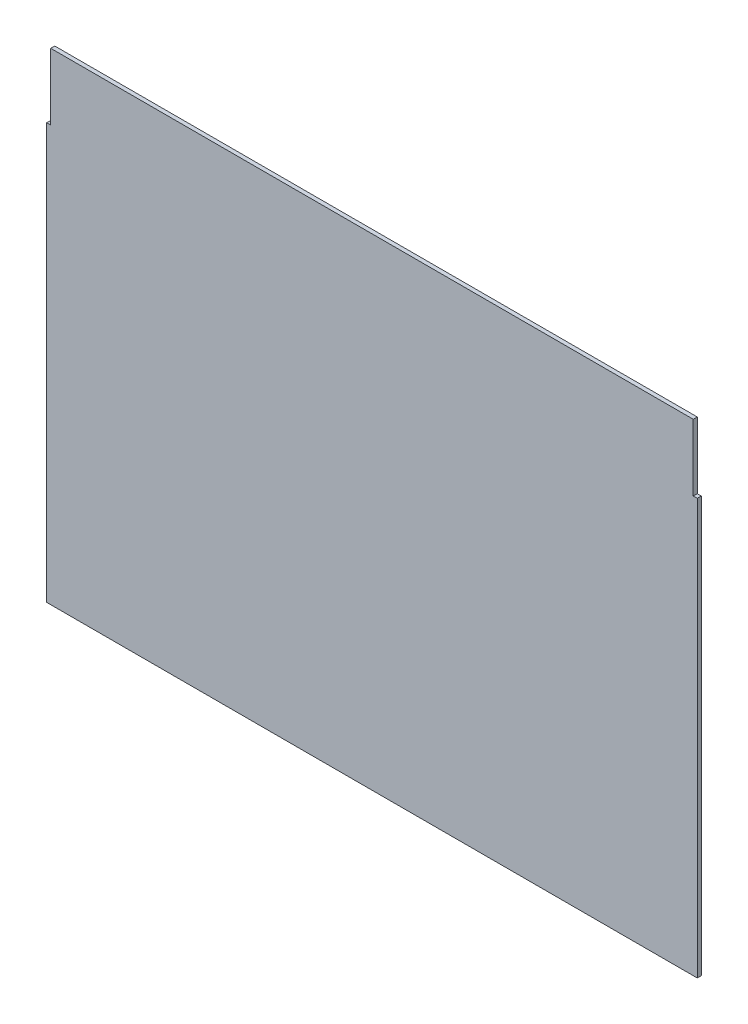
from build123d import *

# Parameters (mm, degrees)
SKETCH1_W           = 508
SKETCH1_H           = 381
BOSS_EXTRUDE1_DEPTH = 3.175
SKETCH4_W           = 3.175
SKETCH4_H           = 328.45375
BOSS_EXTRUDE2_DEPTH = 3.175


with BuildPart() as part:
    # Sketch1 → Boss-Extrude1 (new body)
    with BuildSketch(Plane.XY):
        Rectangle(SKETCH1_W, SKETCH1_H)
    extrude(amount=BOSS_EXTRUDE1_DEPTH)

    # Sketch4 → Boss-Extrude2 (add)
    with BuildSketch(Plane.XY.offset(3.175)):
        with Locations((255.5875, -26.273125)):
            Rectangle(SKETCH4_W, SKETCH4_H)
        with Locations((-255.5875, -26.273125)):
            Rectangle(SKETCH4_W, SKETCH4_H)
    extrude(amount=-BOSS_EXTRUDE2_DEPTH)


solid = part.part
